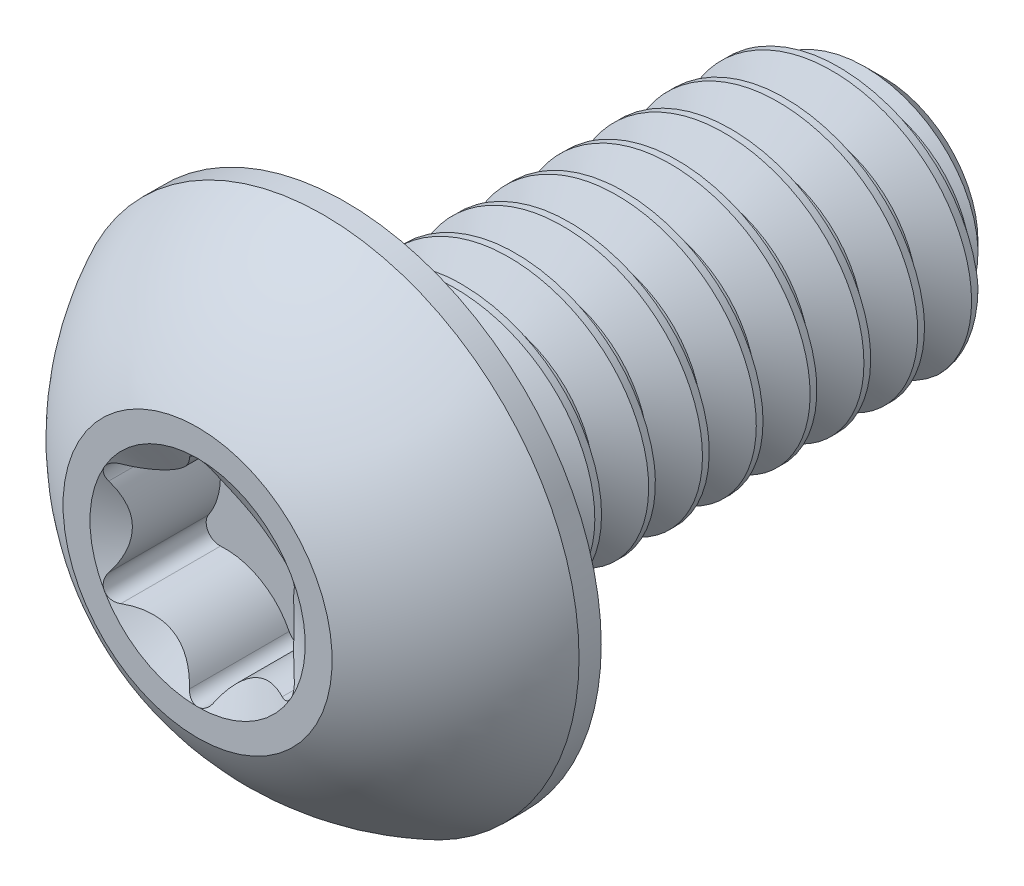
from build123d import *

# Parameters (mm, degrees)
SKETCH1_W          = 4
SKETCH1_H          = 1
CHAMFER1_SIZE      = 0.3
CUT_SWEEP1_PITCH   = 0.4
CUT_EXTRUDE2_DEPTH = 0.77
CIRPATTERN1_COUNT  = 6


with BuildPart() as part:
    # Sketch1 → Revolve1 (revolve)
    with BuildSketch(Plane(origin=(0, 0, 0), x_dir=(0, 0, -1), z_dir=(1, 0, 0))):
        with Locations((3.1, 0.5)):
            Rectangle(SKETCH1_W, SKETCH1_H)
    revolve(axis=Axis((0, 0, -5.1), (0, 0, 1)))

    # Chamfer1
    chamfer1_edges = [part.edges().sort_by_distance(p)[0] for p in [
        (0, -1, -5.1),
    ]]
    chamfer(chamfer1_edges, length=CHAMFER1_SIZE)

    # Cut-Sweep1: the profile of Sketch2 profile screwed along a right-hand helix of 11 turns, 6 arcs to a turn; built about Z, then put on its axis
    cut_sweep1_z = Axis((0, 0, 0), (0, 0, 1))
    cut_sweep1_corners = [(1.0003, 0, 0.000173205), (1.0003, 0, -0.350173205), (0.740192379, 0, -0.2), (0.740192379, 0, -0.15)]
    with BuildLine(mode=Mode.PRIVATE) as cut_sweep1_profile:
        Line(cut_sweep1_corners[0], cut_sweep1_corners[1])
        Line(cut_sweep1_corners[1], cut_sweep1_corners[2])
        Line(cut_sweep1_corners[2], cut_sweep1_corners[3])
        Line(cut_sweep1_corners[3], cut_sweep1_corners[0])
    cut_sweep1_cap = Face(cut_sweep1_profile.wire())
    cut_sweep1_turn_angles = [0, 30, 60, 90, 120, 150, 180, 210, 240, 270, 300, 330, 360]
    cut_sweep1_turn_weights = [1, 0.8660254037844387, 1, 0.8660254037844387, 1, 0.8660254037844387, 1, 0.8660254037844387, 1, 0.8660254037844387, 1, 0.8660254037844387, 1]
    cut_sweep1_turn_rails = [Edge.make_bspline([Vector(p[0], p[1], 0).rotate(cut_sweep1_z, cut_sweep1_turn_angles[k]) / cut_sweep1_turn_weights[k] + Vector(0, 0, p[2] + CUT_SWEEP1_PITCH * cut_sweep1_turn_angles[k] / 360) for k in range(13)], [0, 0, 0, 1, 1, 2, 2, 3, 3, 4, 4, 5, 5, 6, 6, 6], 2, cut_sweep1_turn_weights) for p in cut_sweep1_corners]
    cut_sweep1_turn_sides = [Face.make_surface_from_curves(cut_sweep1_turn_rails[p[0]], cut_sweep1_turn_rails[p[1]]) for p in [(0, 1), (1, 2), (2, 3), (3, 0)]]
    cut_sweep1 = Plane(origin=(0, 0, -5.1), x_dir=(0, 1, 0), z_dir=(0, 0, 1)) * Solid(Shell([*[p.moved(Location((0, 0, CUT_SWEEP1_PITCH * i))) for i in range(11) for p in cut_sweep1_turn_sides], cut_sweep1_cap, cut_sweep1_cap.rotate(cut_sweep1_z, 3960).moved(Location((0, 0, CUT_SWEEP1_PITCH * 3960 / 360)))]))
    add(cut_sweep1, mode=Mode.SUBTRACT)

    # Sketch7 → Revolve2 (revolve)
    with BuildSketch(Plane(origin=(0, 0, 0), x_dir=(0, 0, -1), z_dir=(1, 0, 0)), mode=Mode.PRIVATE) as revolve2_sk:
        with BuildLine():
            Line((0.935, 1.9), (1.1, 1.9))
            Line((1.1, 1.9), (1.1, 0))
            Line((1.1, 0), (0, 0))
            Line((0, 0), (0, 1))
            ThreePointArc((0, 1), (0.396750073, 1.523501313), (0.935, 1.9))
        make_face()
    revolve(revolve2_sk.sketch.rotate(Axis((0, 0, 0), (0, 0, -1)), 189.336081704), axis=Axis((0, 0, 0), (0, 0, -1)))

    # Sketch5 → Cut-Extrude2 (cut)
    with BuildSketch(Plane.XY):
        with BuildLine():
            Line((0, 0), (-0.692820323, 0.4))
            ThreePointArc((-0.692820323, 0.4), (-0.706163843, 0.346715947), (-0.68935124, 0.294422772))
            ThreePointArc((-0.68935124, 0.294422772), (-0.6, 0), (-0.68935124, -0.294422772))
            ThreePointArc((-0.68935124, -0.294422772), (-0.706163843, -0.346715947), (-0.692820323, -0.4))
            Line((-0.692820323, -0.4), (0, 0))
        make_face()
    cut_extrude2 = extrude(amount=-CUT_EXTRUDE2_DEPTH, mode=Mode.SUBTRACT)

    # CirPattern1: Cut-Extrude2 ×6 about axis
    cirpattern1_axis = Axis((0, 0, 0), (0, 0, 1))
    for i in range(1, CIRPATTERN1_COUNT):
        add(cut_extrude2.rotate(cirpattern1_axis, i * 360 / CIRPATTERN1_COUNT), mode=Mode.SUBTRACT)

    # Cut-Extrude3 cone 1 section (through the dimple's axis) → Cut-Extrude3 (revolve, cut)
    with BuildSketch(Plane(origin=(0, 0, 0), x_dir=(0, -1, 0), z_dir=(1, 0, 0))):
        Polygon((0, 0), (0.8, 0), (0, 0.461880215), align=None)
    revolve(axis=Axis((0, 0, 0), (0, 0, -1)), mode=Mode.SUBTRACT)


solid = part.part
